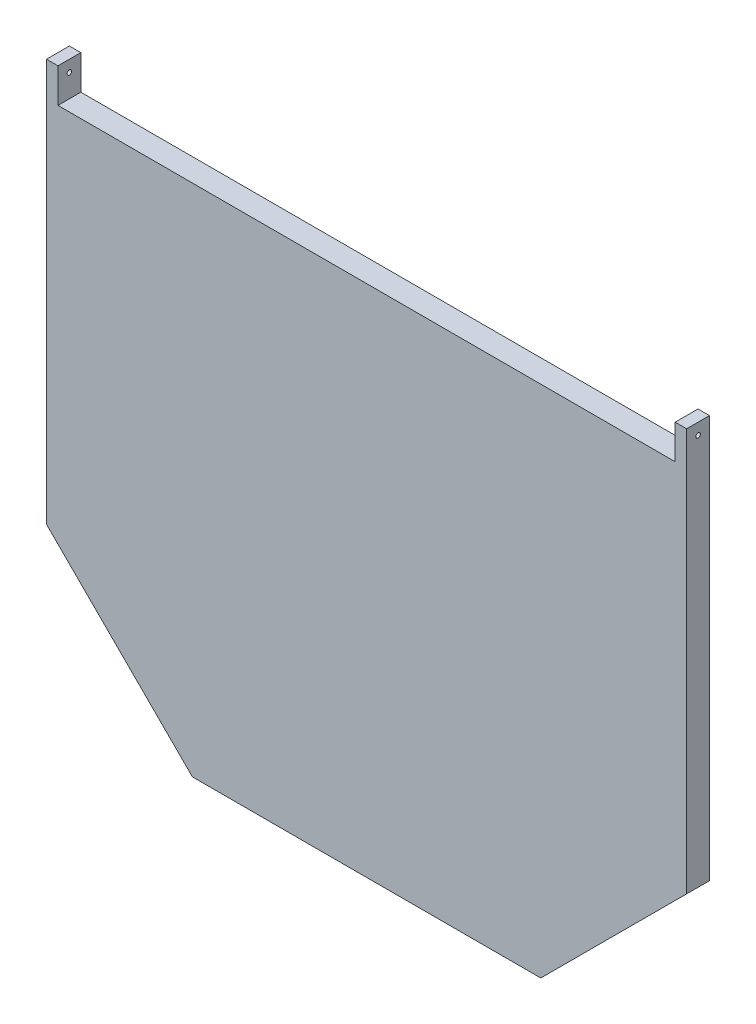
from build123d import *

# Parameters (mm, degrees)
BOSS_EXTRUDE1_DEPTH = 12.7
SKETCH2_W           = 342.9
SKETCH2_H           = 19.05
CUT_EXTRUDE1_DEPTH  = 469.493668777
SKETCH3_R           = 1.27
CUT_EXTRUDE2_DEPTH  = 469.493668777


with BuildPart() as part:
    # Sketch1 → Boss-Extrude1 (new body)
    with BuildSketch(Plane.XY):
        Polygon((0, 0), (355.6, 0), (355.6, -223.774), (274.574, -304.751813258), (81.026, -304.751813258), (0, -223.774), align=None)
    extrude(amount=BOSS_EXTRUDE1_DEPTH)

    # Sketch2 → Cut-Extrude1 (cut, through all)
    with BuildSketch(Plane.XY.offset(12.7)):
        with Locations((177.8, -9.525)):
            Rectangle(SKETCH2_W, SKETCH2_H)
    extrude(amount=-CUT_EXTRUDE1_DEPTH, mode=Mode.SUBTRACT)

    # Sketch3 → Cut-Extrude2 (cut, through all)
    with BuildSketch(Plane.ZY):
        with Locations((6.35, -6.35)):
            Circle(SKETCH3_R)
    extrude(amount=-CUT_EXTRUDE2_DEPTH, mode=Mode.SUBTRACT)


solid = part.part
